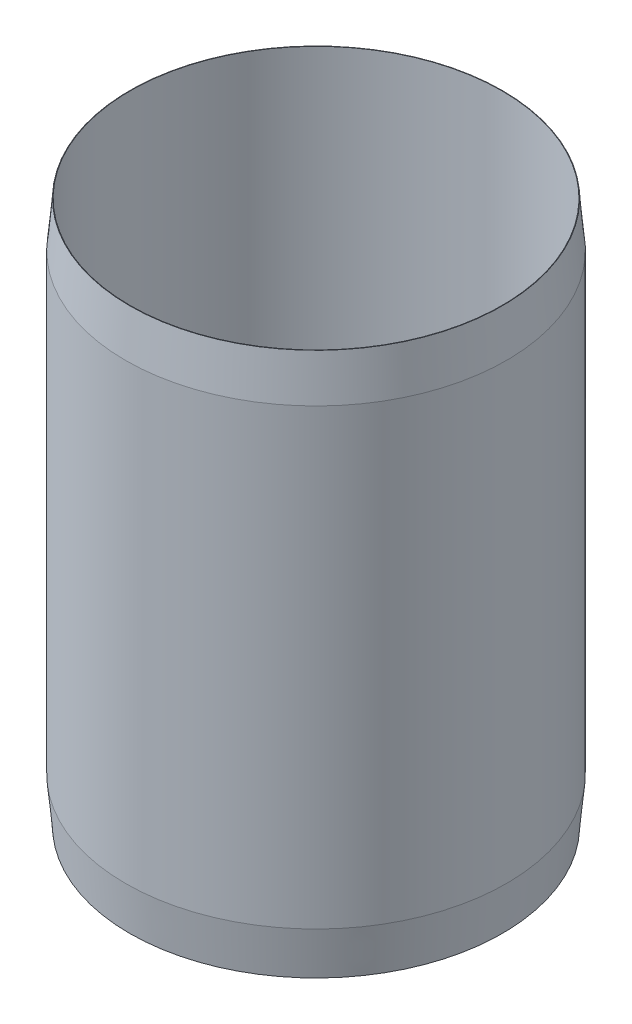
from build123d import *

# Parameters (mm, degrees)
SKETCH1_R           = 42.05
SKETCH1_R_2         = 41.05
BOSS_EXTRUDE1_DEPTH = 120
CHAMFER1_SIZE       = 10
CHAMFER1_SIZE2      = 0.9
CHAMFER2_SIZE       = 0.9
CHAMFER2_SIZE2      = 10


with BuildPart() as part:
    # Sketch1 → Boss-Extrude1 (new body)
    with BuildSketch(Plane(origin=(0, 0, 0), x_dir=(1, 0, 0), z_dir=(0, 1, 0))):
        Circle(SKETCH1_R)
        Circle(SKETCH1_R_2, mode=Mode.SUBTRACT)
    extrude(amount=BOSS_EXTRUDE1_DEPTH)

    # Chamfer1
    chamfer1_edges = [part.edges().sort_by_distance(p)[0] for p in [
        (-42.05, 120, 0),
    ]]
    chamfer1_side = [part.faces().sort_by_distance(p)[0] for p in [
        (-42.05, 60, 0),
    ]]
    chamfer(chamfer1_edges, length=CHAMFER1_SIZE, length2=CHAMFER1_SIZE2, reference=chamfer1_side[0])

    # Chamfer2
    chamfer2_edges = [part.edges().sort_by_distance(p)[0] for p in [
        (-42.05, 0, 0),
    ]]
    chamfer2_side = [part.faces().sort_by_distance(p)[0] for p in [
        (-41.931064639, 0, 0),
    ]]
    chamfer(chamfer2_edges, length=CHAMFER2_SIZE, length2=CHAMFER2_SIZE2, reference=chamfer2_side[0])


solid = part.part
